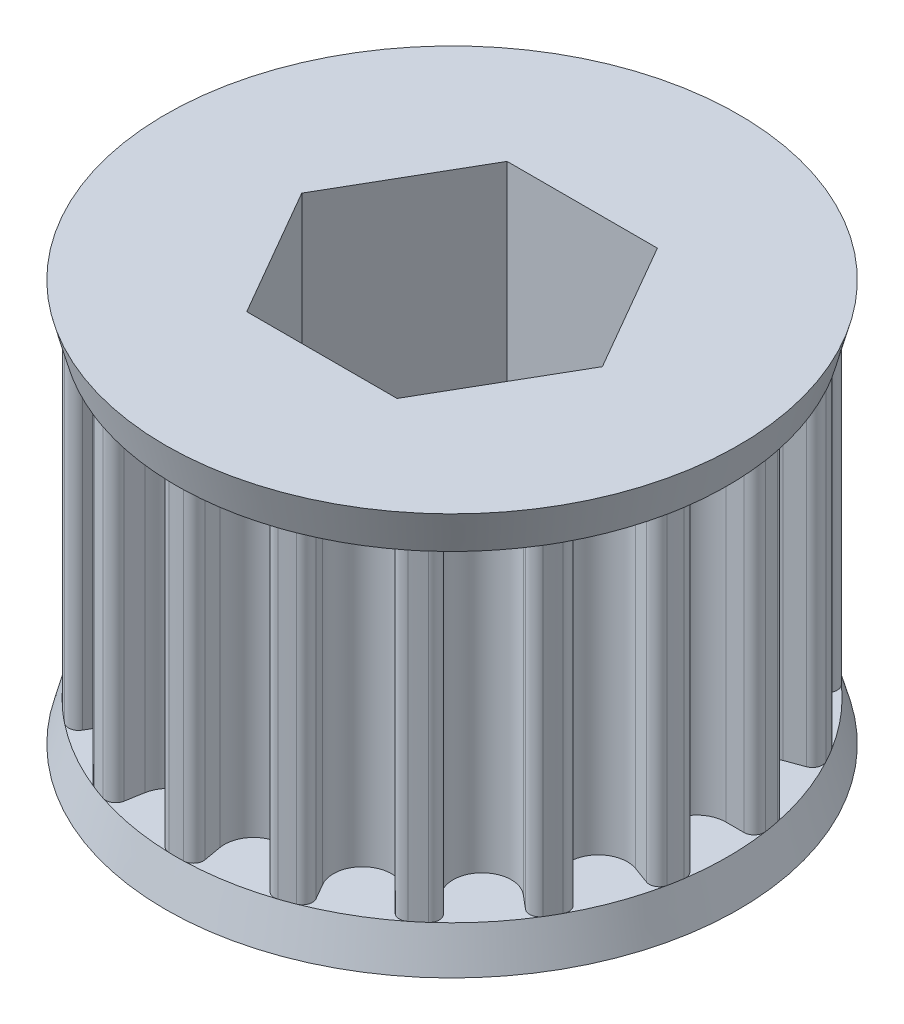
from build123d import *

# Parameters (mm, degrees)
BOSS_EXTRUDE1_DEPTH     = 8
CUT_EXTRUDE1_START      = -8
CUT_EXTRUDE1_DEPTH      = 16
FILLET1_R               = 0.5
CIRPATTERN1_START       = -8
CIRPATTERN1_DEPTH       = 16
CUT_EXTRUDE2_DEPTH      = 23.509692574
CUT_EXTRUDE2_DEPTH_BACK = 23.509692574


# Read off the part's stored shape, not the designer's step: Cut-Extrude1, CirPattern1
with BuildPart() as part:
    # Sketch5 → Boss-Extrude1 (new, symmetric)
    with BuildSketch(Plane(origin=(0, 0, 0), x_dir=(1, 0, 0), z_dir=(0, 1, 0))):
        with BuildLine():
            ThreePointArc((-0.94182805, 13.691589497), (-2.383138019, 13.515447318), (-3.797770534, 13.188009781))
            Line((-3.797770534, 13.188009781), (-3.541954585, 11.737205443))
            ThreePointArc((-3.541954585, 11.737205443), (-1.862193486, 10.561024059), (-0.686012101, 12.240785158))
            Line((-0.686012101, 12.240785158), (-0.94182805, 13.691589497))
        make_face()
        with BuildLine():
            Line((-3.541954585, 11.737205443), (-3.797770534, 13.188009781))
            ThreePointArc((-3.797770534, 13.188009781), (-8.253068204, -10.965105027), (13.723944878, 0))
            ThreePointArc((13.723944878, 0), (9.365390189, 10.031756059), (-0.94182805, 13.691589497))
            Line((-0.94182805, 13.691589497), (-0.686012101, 12.240785158))
            ThreePointArc((-0.686012101, 12.240785158), (-1.862193486, 10.561024059), (-3.541954585, 11.737205443))
        make_face()
    extrude(amount=BOSS_EXTRUDE1_DEPTH, both=True)

    # Cut-Extrude1 outline → Cut-Extrude1 (cut)
    with BuildSketch(Plane(origin=(0, 0, 0), x_dir=(1, 0, 0), z_dir=(0, 1, 0)).offset(CUT_EXTRUDE1_START)):
        with BuildLine():
            ThreePointArc((-0.94182805, 13.691589496), (-2.383138019, 13.515447318), (-3.797770534, 13.188009781))
            Line((-3.797770534, 13.188009781), (-3.541954585, 11.737205443))
            ThreePointArc((-3.541954585, 11.737205443), (-1.862193486, 10.561024059), (-0.686012101, 12.240785158))
            Line((-0.686012101, 12.240785158), (-0.94182805, 13.691589496))
        make_face()
    extrude(amount=CUT_EXTRUDE1_DEPTH, mode=Mode.SUBTRACT)

    # Fillet1
    fillet1_edges = [part.edges().sort_by_distance(p)[0] for p in [
        (-3.797770534, 0, -13.188009781),
        (-0.94182805, 0, -13.691589497),
    ]]
    fillet(fillet1_edges, radius=FILLET1_R)

    # CirPattern1 outline → CirPattern1 (cut)
    with BuildSketch(Plane(origin=(0, 0, 0), x_dir=(1, 0, 0), z_dir=(0, 1, 0)).offset(CIRPATTERN1_START)):
        with BuildLine():
            ThreePointArc((3.699181989, 12.628886362), (3.935863375, 12.971720286), (4.350070565, 13.016280156))
            ThreePointArc((4.350070565, 13.016280156), (2.383138018, 13.515447318), (0.364100794, 13.719114171))
            ThreePointArc((0.364100794, 13.719114171), (0.738087861, 13.535574388), (0.843239505, 13.132466078))
            Line((0.843239505, 13.132466078), (0.686012101, 12.240785158))
            ThreePointArc((0.686012101, 12.240785158), (1.862193486, 10.561024059), (3.541954585, 11.737205443))
            Line((3.541954585, 11.737205443), (3.699181989, 12.628886362))
        make_face()
        with BuildLine():
            ThreePointArc((7.795427542, 10.602076569), (8.135091402, 10.843285276), (8.539559215, 10.743490654))
            ThreePointArc((8.539559215, 10.743490654), (6.86197244, 11.885284905), (5.034356225, 12.767220544))
            ThreePointArc((5.034356225, 12.767220544), (5.323014809, 12.466838454), (5.283953871, 12.052076569))
            Line((5.283953871, 12.052076569), (4.831235604, 11.267945529))
            ThreePointArc((4.831235604, 11.267945529), (5.361972439, 9.287208693), (7.342709275, 9.817945529))
            Line((7.342709275, 9.817945529), (7.795427542, 10.602076569))
        make_face()
        with BuildLine():
            ThreePointArc((10.951429485, 7.296499872), (11.353107344, 7.406990032), (11.699050992, 7.174877623))
            ThreePointArc((11.699050992, 7.174877623), (10.513151712, 8.821581724), (9.097393995, 10.275411696))
            ThreePointArc((9.097393995, 10.275411696), (9.265907611, 9.894417812), (9.087345417, 9.518028757))
            Line((9.087345417, 9.518028757), (8.393740791, 8.936025371))
            ThreePointArc((8.393740791, 8.936025371), (8.215018382, 6.893218894), (10.257824859, 6.714496486))
            Line((10.257824859, 6.714496486), (10.951429485, 7.296499872))
        make_face()
        with BuildLine():
            ThreePointArc((12.786527406, 3.110857605), (13.201770987, 3.077302474), (13.447464561, 2.74086846))
            ThreePointArc((13.447464561, 2.74086846), (12.896289731, 4.693865594), (12.063151787, 6.544236548))
            ThreePointArc((12.063151787, 6.544236548), (12.091195205, 6.128584356), (11.79466899, 5.835966206))
            Line((11.79466899, 5.835966206), (10.94383696, 5.526288672))
            ThreePointArc((10.94383696, 5.526288672), (10.077211868, 3.667805164), (11.935695376, 2.801180072))
            Line((11.935695376, 2.801180072), (12.786527406, 3.110857605))
        make_face()
        with BuildLine():
            ThreePointArc((13.079381413, -1.45), (13.458106211, -1.623553178), (13.573915439, -2.02372989))
            ThreePointArc((13.573915439, -2.02372989), (13.723944879, 0), (13.57391544, 2.02372989))
            ThreePointArc((13.57391544, 2.02372989), (13.458106211, 1.623553178), (13.079381413, 1.45))
            Line((13.079381413, 1.45), (12.173944878, 1.45))
            ThreePointArc((12.173944878, 1.45), (10.723944878, 0), (12.173944878, -1.45))
            Line((12.173944878, -1.45), (13.079381413, -1.45))
        make_face()
        with BuildLine():
            ThreePointArc((11.79466899, -5.835966206), (12.091195205, -6.128584356), (12.063151787, -6.544236548))
            ThreePointArc((12.063151787, -6.544236548), (12.896289731, -4.693865594), (13.447464561, -2.74086846))
            ThreePointArc((13.447464561, -2.74086846), (13.201770987, -3.077302474), (12.786527406, -3.110857605))
            Line((12.786527406, -3.110857605), (11.935695376, -2.801180072))
            ThreePointArc((11.935695376, -2.801180072), (10.077211868, -3.667805164), (10.94383696, -5.526288672))
            Line((10.94383696, -5.526288672), (11.79466899, -5.835966206))
        make_face()
        with BuildLine():
            ThreePointArc((9.087345417, -9.518028757), (9.265907611, -9.894417812), (9.097393995, -10.275411696))
            ThreePointArc((9.097393995, -10.275411696), (10.513151712, -8.821581724), (11.699050993, -7.174877623))
            ThreePointArc((11.699050993, -7.174877623), (11.353107344, -7.406990032), (10.951429485, -7.296499872))
            Line((10.951429485, -7.296499872), (10.257824859, -6.714496486))
            ThreePointArc((10.257824859, -6.714496486), (8.215018382, -6.893218894), (8.393740791, -8.936025371))
            Line((8.393740791, -8.936025371), (9.087345417, -9.518028757))
        make_face()
        with BuildLine():
            ThreePointArc((5.283953871, -12.052076569), (5.323014809, -12.466838454), (5.034356225, -12.767220544))
            ThreePointArc((5.034356225, -12.767220544), (6.86197244, -11.885284905), (8.539559215, -10.743490654))
            ThreePointArc((8.539559215, -10.743490654), (8.135091402, -10.843285276), (7.795427542, -10.602076569))
            Line((7.795427542, -10.602076569), (7.342709275, -9.817945529))
            ThreePointArc((7.342709275, -9.817945529), (5.361972439, -9.287208693), (4.831235604, -11.267945529))
            Line((4.831235604, -11.267945529), (5.283953871, -12.052076569))
        make_face()
        with BuildLine():
            ThreePointArc((-5.034356225, 12.767220544), (-6.861972439, 11.885284904), (-8.539559215, 10.743490654))
            ThreePointArc((-8.539559215, 10.743490654), (-8.135091402, 10.843285276), (-7.795427542, 10.602076569))
            Line((-7.795427542, 10.602076569), (-7.342709275, 9.817945529))
            ThreePointArc((-7.342709275, 9.817945529), (-5.361972439, 9.287208693), (-4.831235604, 11.267945529))
            Line((-4.831235604, 11.267945529), (-5.283953871, 12.052076569))
            ThreePointArc((-5.283953871, 12.052076569), (-5.323014809, 12.466838454), (-5.034356225, 12.767220544))
        make_face()
        with BuildLine():
            ThreePointArc((-9.097393995, 10.275411696), (-10.513151711, 8.821581724), (-11.699050992, 7.174877623))
            ThreePointArc((-11.699050992, 7.174877623), (-11.353107344, 7.406990032), (-10.951429485, 7.296499872))
            Line((-10.951429485, 7.296499872), (-10.257824859, 6.714496486))
            ThreePointArc((-10.257824859, 6.714496486), (-8.215018382, 6.893218894), (-8.393740791, 8.936025371))
            Line((-8.393740791, 8.936025371), (-9.087345417, 9.518028757))
            ThreePointArc((-9.087345417, 9.518028757), (-9.265907611, 9.894417812), (-9.097393995, 10.275411696))
        make_face()
        with BuildLine():
            ThreePointArc((-12.063151786, 6.544236548), (-12.89628973, 4.693865594), (-13.44746456, 2.74086846))
            ThreePointArc((-13.44746456, 2.74086846), (-13.201770987, 3.077302474), (-12.786527406, 3.110857605))
            Line((-12.786527406, 3.110857605), (-11.935695376, 2.801180072))
            ThreePointArc((-11.935695376, 2.801180072), (-10.077211868, 3.667805164), (-10.94383696, 5.526288672))
            Line((-10.94383696, 5.526288672), (-11.79466899, 5.835966206))
            ThreePointArc((-11.79466899, 5.835966206), (-12.091195205, 6.128584356), (-12.063151786, 6.544236548))
        make_face()
        with BuildLine():
            ThreePointArc((-13.573915439, 2.02372989), (-13.723944878, 0), (-13.573915439, -2.02372989))
            ThreePointArc((-13.573915439, -2.02372989), (-13.458106211, -1.623553178), (-13.079381413, -1.45))
            Line((-13.079381413, -1.45), (-12.173944878, -1.45))
            ThreePointArc((-12.173944878, -1.45), (-10.723944878, 0), (-12.173944878, 1.45))
            Line((-12.173944878, 1.45), (-13.079381413, 1.45))
            ThreePointArc((-13.079381413, 1.45), (-13.458106211, 1.623553178), (-13.573915439, 2.02372989))
        make_face()
        with BuildLine():
            ThreePointArc((-13.44746456, -2.74086846), (-12.89628973, -4.693865594), (-12.063151786, -6.544236548))
            ThreePointArc((-12.063151786, -6.544236548), (-12.091195205, -6.128584356), (-11.79466899, -5.835966206))
            Line((-11.79466899, -5.835966206), (-10.94383696, -5.526288672))
            ThreePointArc((-10.94383696, -5.526288672), (-10.077211868, -3.667805164), (-11.935695376, -2.801180072))
            Line((-11.935695376, -2.801180072), (-12.786527406, -3.110857605))
            ThreePointArc((-12.786527406, -3.110857605), (-13.201770987, -3.077302474), (-13.44746456, -2.74086846))
        make_face()
        with BuildLine():
            ThreePointArc((-11.699050992, -7.174877623), (-10.513151711, -8.821581724), (-9.097393995, -10.275411696))
            ThreePointArc((-9.097393995, -10.275411696), (-9.265907611, -9.894417812), (-9.087345417, -9.518028757))
            Line((-9.087345417, -9.518028757), (-8.393740791, -8.936025371))
            ThreePointArc((-8.393740791, -8.936025371), (-8.215018382, -6.893218894), (-10.257824859, -6.714496486))
            Line((-10.257824859, -6.714496486), (-10.951429485, -7.296499872))
            ThreePointArc((-10.951429485, -7.296499872), (-11.353107344, -7.406990032), (-11.699050992, -7.174877623))
        make_face()
        with BuildLine():
            ThreePointArc((-8.539559215, -10.743490654), (-6.861972439, -11.885284904), (-5.034356225, -12.767220544))
            ThreePointArc((-5.034356225, -12.767220544), (-5.323014809, -12.466838454), (-5.283953871, -12.052076569))
            Line((-5.283953871, -12.052076569), (-4.831235604, -11.267945529))
            ThreePointArc((-4.831235604, -11.267945529), (-5.361972439, -9.287208693), (-7.342709275, -9.817945529))
            Line((-7.342709275, -9.817945529), (-7.795427542, -10.602076569))
            ThreePointArc((-7.795427542, -10.602076569), (-8.135091402, -10.843285276), (-8.539559215, -10.743490654))
        make_face()
        with BuildLine():
            ThreePointArc((-4.350070565, -13.016280156), (-2.383138018, -13.515447318), (-0.364100794, -13.719114171))
            ThreePointArc((-0.364100794, -13.719114171), (-0.738087861, -13.535574388), (-0.843239505, -13.132466078))
            Line((-0.843239505, -13.132466078), (-0.686012101, -12.240785158))
            ThreePointArc((-0.686012101, -12.240785158), (-1.862193486, -10.561024059), (-3.541954585, -11.737205443))
            Line((-3.541954585, -11.737205443), (-3.699181989, -12.628886362))
            ThreePointArc((-3.699181989, -12.628886362), (-3.935863375, -12.971720286), (-4.350070565, -13.016280156))
        make_face()
        with BuildLine():
            Line((0.686012101, -12.240785158), (0.843239505, -13.132466078))
            ThreePointArc((0.843239505, -13.132466078), (0.738087861, -13.535574388), (0.364100794, -13.719114171))
            ThreePointArc((0.364100794, -13.719114171), (2.383138018, -13.515447318), (4.350070565, -13.016280156))
            ThreePointArc((4.350070565, -13.016280156), (3.935863375, -12.971720286), (3.699181989, -12.628886362))
            Line((3.699181989, -12.628886362), (3.541954585, -11.737205443))
            ThreePointArc((3.541954585, -11.737205443), (1.862193486, -10.561024059), (0.686012101, -12.240785158))
        make_face()
    extrude(amount=CIRPATTERN1_DEPTH, mode=Mode.SUBTRACT)

    # Sketch7 → Revolve1 (revolve)
    with BuildSketch(Plane.XY, mode=Mode.PRIVATE) as revolve1_sk:
        Polygon((-13.723944878, 8), (0, 8), (0, 10), (-14.259843263, 10), align=None)
    revolve1 = revolve(revolve1_sk.sketch.rotate(Axis((0, 31.963433296, 0), (0, -1, 0)), 270), axis=Axis((0, 31.963433296, 0), (0, -1, 0)))

    # Mirror1: Revolve1 across plane
    add(revolve1.mirror(Plane.ZX))

    # Sketch8 → Cut-Extrude2 (cut, two sides: drawn at the far end of the back side and taken through both)
    with BuildSketch(Plane(origin=(0, 0, 0), x_dir=(1, 0, 0), z_dir=(0, 1, 0)).offset(-CUT_EXTRUDE2_DEPTH_BACK)):
        Polygon((7.478995387, 0), (3.739497694, 6.477), (-3.739497694, 6.477), (-7.478995387, 0), (-3.739497694, -6.477), (3.739497694, -6.477), align=None)
    extrude(amount=CUT_EXTRUDE2_DEPTH + CUT_EXTRUDE2_DEPTH_BACK, mode=Mode.SUBTRACT)


solid = part.part
